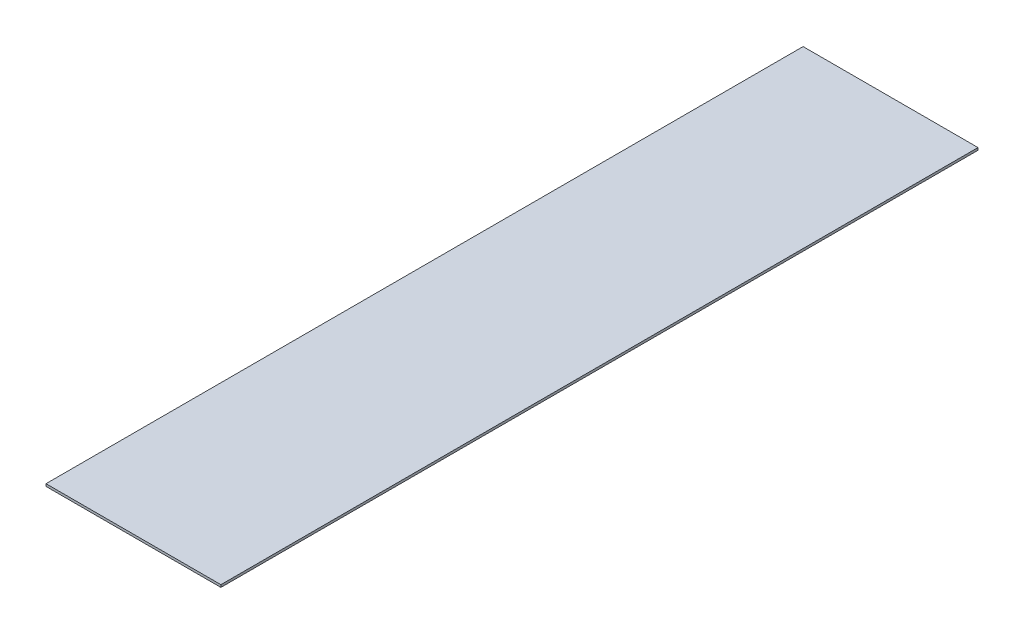
from build123d import *

# Parameters (mm, degrees)
SKETCH1_W           = 185.42
SKETCH1_H           = 802.64
BOSS_EXTRUDE1_DEPTH = 2.54


with BuildPart() as part:
    # Sketch1 → Boss-Extrude1 (new body)
    with BuildSketch(Plane(origin=(0, 0, 0), x_dir=(1, 0, 0), z_dir=(0, 1, 0))):
        with Locations((2.261219512, -318.785487805)):
            Rectangle(SKETCH1_W, SKETCH1_H)
    extrude(amount=BOSS_EXTRUDE1_DEPTH)


solid = part.part
